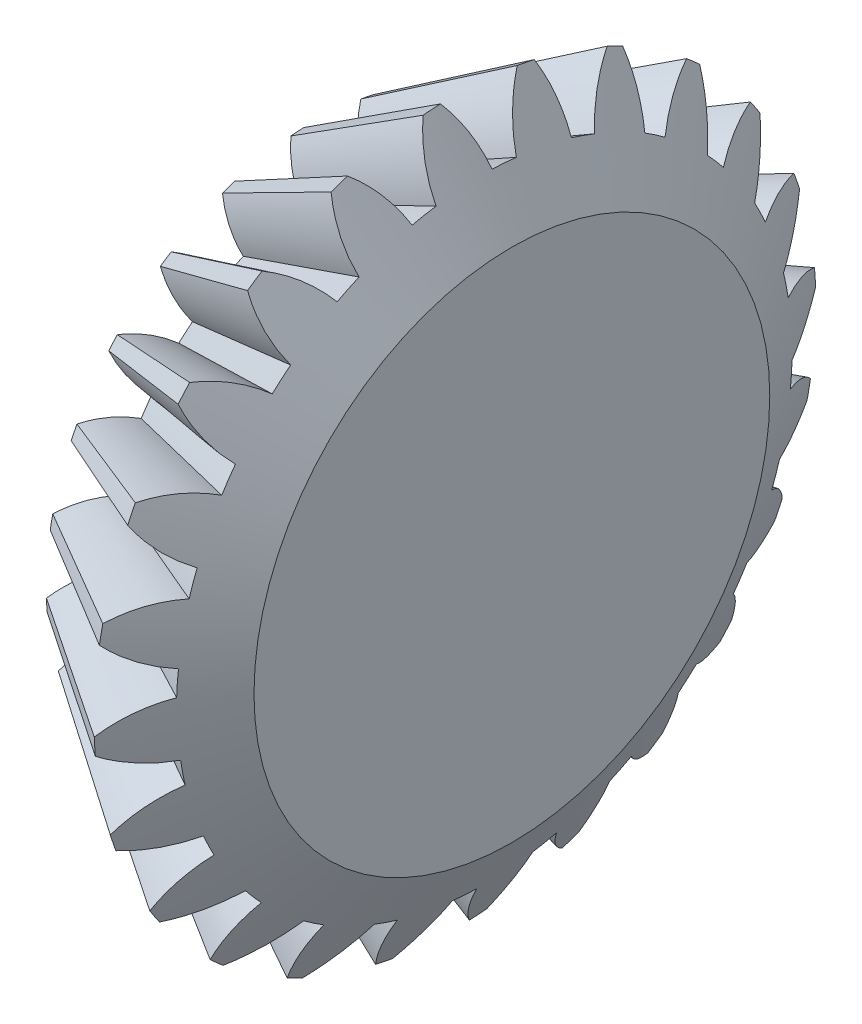
from build123d import *

# Parameters (mm, degrees)
CIRPATTERN1_COUNT = 24


with BuildPart() as part:
    # Sketch1 → Revolve1 (revolve)
    with BuildSketch(Plane.XY):
        Polygon((-0.278093155, 7.403278449), (0.889898095, 5.289508963), (0.889898095, 0), (-2.378988105, 0), (-2.378988105, 4.093860275), (-3.157870731, 5.503441321), align=None)
    revolve(axis=Axis((0, 0, 0), (-1, 0, 0)))

    # Sketch2 → Cut-Loft1 section 0
    with BuildSketch(Plane(origin=(2.920868695, 1.613964579, -2.66e-07), x_dir=(-6.965671252780543e-08, -3.848973660226184e-08, -0.9999999999999968), z_dir=(0.875266867862521, 0.48364026923130166, -7.958339917277234e-08)), mode=Mode.PRIVATE) as cut_loft1_s0:
        with BuildLine():
            ThreePointArc((-0.673653241, 7.050054812), (-0.105872301, 6.283149308), (0.158601997, 5.366321846))
            ThreePointArc((0.158601997, 5.366321846), (0.407394495, 5.355004562), (0.655535736, 5.333751016))
            ThreePointArc((0.655535736, 5.333751016), (1.037417668, 6.208213959), (1.700442616, 6.894448006))
            ThreePointArc((1.700442616, 6.894448006), (0.519256628, 7.061687138), (-0.673653241, 7.050054812))
        make_face()
    cut_loft1 = loft([Vertex(-11.5, 0, 0), cut_loft1_s0.sketch], mode=Mode.SUBTRACT)

    # CirPattern1: Cut-Loft1 ×24 about axis
    cirpattern1_axis = Axis((-2.378988105, 0, 0), (1, 0, 0))
    for i in range(1, CIRPATTERN1_COUNT):
        add(cut_loft1.rotate(cirpattern1_axis, i * 360 / CIRPATTERN1_COUNT), mode=Mode.SUBTRACT)


solid = part.part
